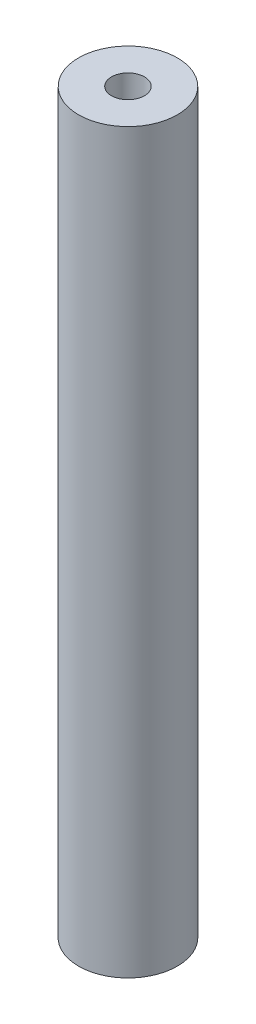
from build123d import *

# Parameters (mm, degrees)
SKETCH1_R           = 47.625
SKETCH1_R_2         = 15.875
BOSS_EXTRUDE1_DEPTH = 355.6


with BuildPart() as part:
    # Sketch1 → Boss-Extrude1 (new, symmetric)
    with BuildSketch(Plane(origin=(0, 0, 0), x_dir=(1, 0, 0), z_dir=(0, 1, 0))):
        Circle(SKETCH1_R)
        Circle(SKETCH1_R_2, mode=Mode.SUBTRACT)
    extrude(amount=BOSS_EXTRUDE1_DEPTH, both=True)


solid = part.part
